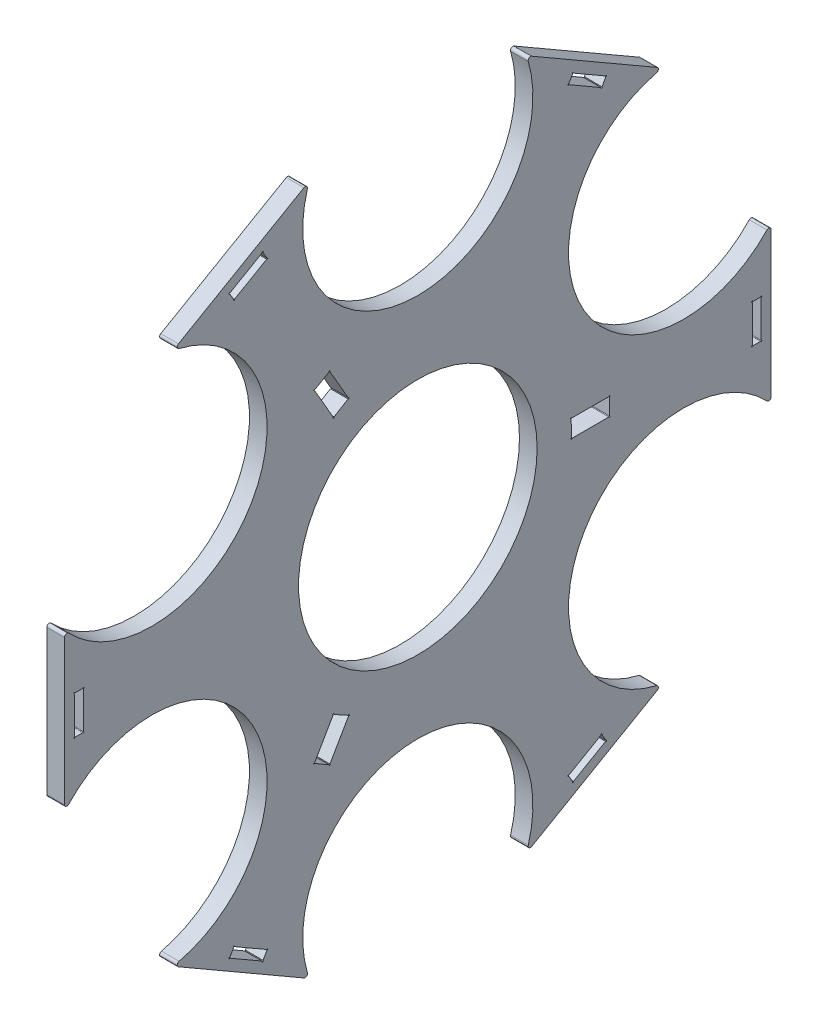
from build123d import *

# Parameters (mm, degrees)
SKETCH2_R           = 39.487475
BOSS_EXTRUDE1_DEPTH = 5.842
FILLET1_R           = 0.79375
CUT_EXTRUDE2_DEPTH  = 163.986308211
CIRPATTERN2_COUNT   = 3
CUT_EXTRUDE5_DEPTH  = 163.986308211


with BuildPart() as part:
    # Sketch2 → Boss-Extrude1 (new body)
    with BuildSketch(Plane(origin=(0, 0, 0), x_dir=(0, 0, -1), z_dir=(1, 0, 0))):
        with BuildLine():
            ThreePointArc((116.947215895, 26.041480267), (54.99261314, 31.75), (81.02619141, 88.258519733))
            Line((81.02619141, 88.258519733), (35.921024484, 114.3))
            ThreePointArc((35.921024484, 114.3), (0, 63.5), (-35.921024484, 114.3))
            Line((-35.921024484, 114.3), (-81.02619141, 88.258519733))
            ThreePointArc((-81.02619141, 88.258519733), (-54.99261314, 31.75), (-116.947215895, 26.041480267))
            Line((-116.947215895, 26.041480267), (-116.947215895, -26.041480267))
            ThreePointArc((-116.947215895, -26.041480267), (-54.99261314, -31.75), (-81.02619141, -88.258519733))
            Line((-81.02619141, -88.258519733), (-35.921024484, -114.3))
            ThreePointArc((-35.921024484, -114.3), (0, -63.5), (35.921024484, -114.3))
            Line((35.921024484, -114.3), (81.02619141, -88.258519733))
            ThreePointArc((81.02619141, -88.258519733), (54.99261314, -31.75), (116.947215895, -26.041480267))
            Line((116.947215895, -26.041480267), (116.947215895, 26.041480267))
        make_face()
        Circle(SKETCH2_R, mode=Mode.SUBTRACT)
    extrude(amount=BOSS_EXTRUDE1_DEPTH)

    # Fillet1
    fillet1_edges = [part.edges().sort_by_distance(p)[0] for p in [
        (2.921, -114.3, 35.921024484),
        (2.921, -114.3, -35.921024484),
        (2.921, -88.258519733, -81.02619141),
        (2.921, -26.041480267, -116.947215895),
        (2.921, 88.258519733, -81.02619141),
        (2.921, 26.041480267, -116.947215895),
        (2.921, -88.258519733, 81.02619141),
        (2.921, -26.041480267, 116.947215895),
        (2.921, 26.041480267, 116.947215895),
        (2.921, 88.258519733, 81.02619141),
        (2.921, 114.3, -35.921024484),
        (2.921, 114.3, 35.921024484),
    ]]
    fillet(fillet1_edges, radius=FILLET1_R)

    # Sketch6 → Cut-Extrude2 (cut, through all)
    with BuildSketch(Plane(origin=(5.842, 0, 0), x_dir=(0, 0, -1), z_dir=(1, 0, 0))):
        with BuildLine():
            Line((-23.004455913, 45.686886441), (-29.096698147, 56.238959523))
            ThreePointArc((-29.096698147, 56.238959523), (-29.144557493, 56.602487346), (-29.367768813, 56.311592689))
            Line((-29.367768813, 56.311592689), (-34.08338539, 53.589030189))
            ThreePointArc((-34.08338539, 53.589030189), (-34.446913212, 53.541170844), (-34.156018556, 53.317959523))
            Line((-34.156018556, 53.317959523), (-28.004456056, 42.663140727))
            ThreePointArc((-28.004456056, 42.663140727), (-27.954648068, 42.299101356), (-27.735435356, 42.593976392))
            Line((-27.735435356, 42.593976392), (-23.075039112, 45.412346944))
            ThreePointArc((-23.075039112, 45.412346944), (-22.713049707, 45.465623764), (-23.004455913, 45.686886441))
        make_face()
    cut_extrude2 = extrude(amount=-CUT_EXTRUDE2_DEPTH, mode=Mode.SUBTRACT)

    # CirPattern2: Cut-Extrude2 ×3 about axis
    cirpattern2_axis = Axis((5.842, 0, 0), (-1, 0, 0))
    for i in range(1, CIRPATTERN2_COUNT):
        add(cut_extrude2.rotate(cirpattern2_axis, i * 360 / CIRPATTERN2_COUNT), mode=Mode.SUBTRACT)

    # Sketch11 → Cut-Extrude5 (cut, through all)
    with BuildSketch(Plane.ZY):
        with BuildLine():
            Line((-50.021198549, 98.942382343), (-60.676017345, 92.790819843))
            ThreePointArc((-60.676017345, 92.790819843), (-60.899228666, 92.499925187), (-60.947088011, 92.863453009))
            Line((-60.947088011, 92.863453009), (-62.236150511, 95.096174753))
            ThreePointArc((-62.236150511, 95.096174753), (-62.527045168, 95.319386074), (-62.163517345, 95.367245419))
            Line((-62.163517345, 95.367245419), (-51.508698549, 101.518807919))
            ThreePointArc((-51.508698549, 101.518807919), (-51.285487229, 101.809702575), (-51.237627883, 101.446174753))
            Line((-51.237627883, 101.446174753), (-49.948565383, 99.213453009))
            ThreePointArc((-49.948565383, 99.213453009), (-49.657670727, 98.990241689), (-50.021198549, 98.942382343))
        make_face()
        with BuildLine():
            Line((60.676017345, 92.790819843), (50.021198549, 98.942382343))
            ThreePointArc((50.021198549, 98.942382343), (49.657670727, 98.990241689), (49.948565383, 99.213453009))
            Line((49.948565383, 99.213453009), (51.237627883, 101.446174753))
            ThreePointArc((51.237627883, 101.446174753), (51.285487229, 101.809702575), (51.508698549, 101.518807919))
            Line((51.508698549, 101.518807919), (62.163517345, 95.367245419))
            ThreePointArc((62.163517345, 95.367245419), (62.527045168, 95.319386074), (62.236150511, 95.096174753))
            Line((62.236150511, 95.096174753), (60.947088011, 92.863453009))
            ThreePointArc((60.947088011, 92.863453009), (60.899228666, 92.499925187), (60.676017345, 92.790819843))
        make_face()
        with BuildLine():
            Line((110.697215895, -6.1515625), (110.697215895, 6.1515625))
            ThreePointArc((110.697215895, 6.1515625), (110.556899393, 6.490316502), (110.895653395, 6.35))
            Line((110.895653395, 6.35), (113.473778395, 6.35))
            ThreePointArc((113.473778395, 6.35), (113.812532397, 6.490316502), (113.672215895, 6.1515625))
            Line((113.672215895, 6.1515625), (113.672215895, -6.1515625))
            ThreePointArc((113.672215895, -6.1515625), (113.812532397, -6.490316502), (113.473778395, -6.35))
            Line((113.473778395, -6.35), (110.895653395, -6.35))
            ThreePointArc((110.895653395, -6.35), (110.556899393, -6.490316502), (110.697215895, -6.1515625))
        make_face()
        with BuildLine():
            Line((50.021198549, -98.942382343), (60.676017345, -92.790819843))
            ThreePointArc((60.676017345, -92.790819843), (60.899228666, -92.499925187), (60.947088011, -92.863453009))
            Line((60.947088011, -92.863453009), (62.236150511, -95.096174753))
            ThreePointArc((62.236150511, -95.096174753), (62.527045168, -95.319386074), (62.163517345, -95.367245419))
            Line((62.163517345, -95.367245419), (51.508698549, -101.518807919))
            ThreePointArc((51.508698549, -101.518807919), (51.285487229, -101.809702575), (51.237627883, -101.446174753))
            Line((51.237627883, -101.446174753), (49.948565383, -99.213453009))
            ThreePointArc((49.948565383, -99.213453009), (49.657670727, -98.990241689), (50.021198549, -98.942382343))
        make_face()
        with BuildLine():
            Line((-60.676017345, -92.790819843), (-50.021198549, -98.942382343))
            ThreePointArc((-50.021198549, -98.942382343), (-49.657670727, -98.990241689), (-49.948565383, -99.213453009))
            Line((-49.948565383, -99.213453009), (-51.237627883, -101.446174753))
            ThreePointArc((-51.237627883, -101.446174753), (-51.285487229, -101.809702575), (-51.508698549, -101.518807919))
            Line((-51.508698549, -101.518807919), (-62.163517345, -95.367245419))
            ThreePointArc((-62.163517345, -95.367245419), (-62.527045168, -95.319386074), (-62.236150511, -95.096174753))
            Line((-62.236150511, -95.096174753), (-60.947088011, -92.863453009))
            ThreePointArc((-60.947088011, -92.863453009), (-60.899228666, -92.499925187), (-60.676017345, -92.790819843))
        make_face()
        with BuildLine():
            Line((-110.697215895, 6.1515625), (-110.697215895, -6.1515625))
            ThreePointArc((-110.697215895, -6.1515625), (-110.556899393, -6.490316502), (-110.895653395, -6.35))
            Line((-110.895653395, -6.35), (-113.473778395, -6.35))
            ThreePointArc((-113.473778395, -6.35), (-113.812532397, -6.490316502), (-113.672215895, -6.1515625))
            Line((-113.672215895, -6.1515625), (-113.672215895, 6.1515625))
            ThreePointArc((-113.672215895, 6.1515625), (-113.812532397, 6.490316502), (-113.473778395, 6.35))
            Line((-113.473778395, 6.35), (-110.895653395, 6.35))
            ThreePointArc((-110.895653395, 6.35), (-110.556899393, 6.490316502), (-110.697215895, 6.1515625))
        make_face()
    extrude(amount=-CUT_EXTRUDE5_DEPTH, mode=Mode.SUBTRACT)


solid = part.part
